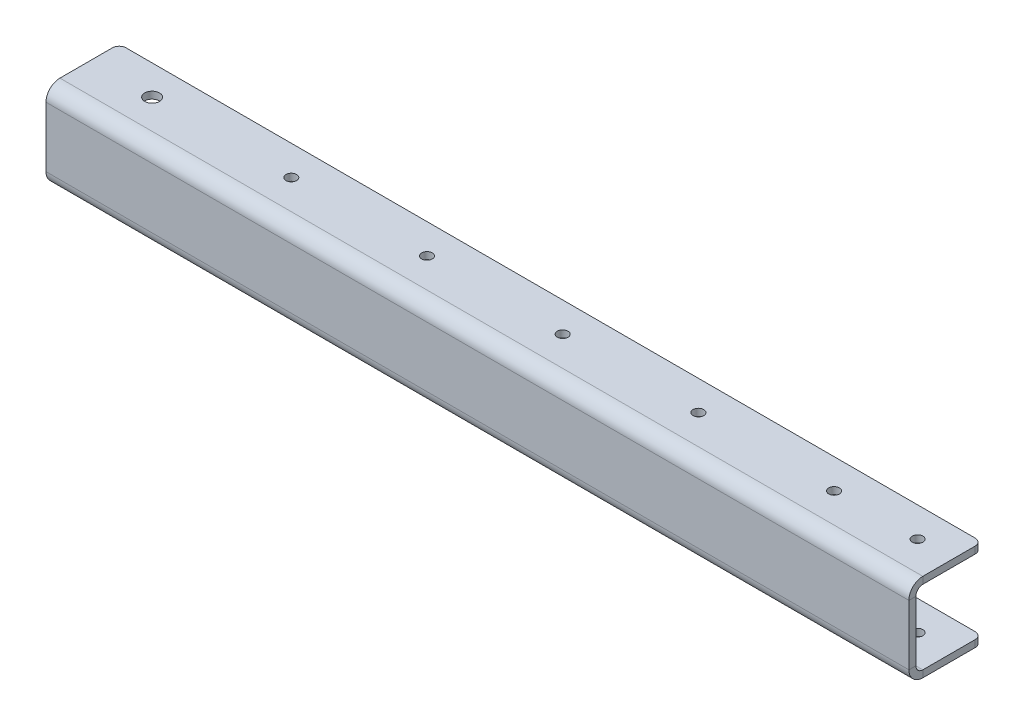
from build123d import *

# Parameters (mm, degrees)
BASE_FLANGE1_DEPTH = 393.7
SKETCH6_R          = 3.3782
SKETCH6_R_2        = 2.4257
CUT_EXTRUDE1_DEPTH = 397.892779602
FILLET1_R          = 3.175


# Sheet-metal steps are written as plain solids
with BuildPart() as part:
    # Sketch1 → Base-Flange1 (new body)
    with BuildSketch(Plane(origin=(0, 0, 0), x_dir=(0, 0, -1), z_dir=(1, 0, 0))):
        with BuildLine():
            Line((30.226, 33.782), (3.175, 33.782))
            ThreePointArc((3.175, 33.782), (0.92993597, 32.85206403), (0, 30.607))
            Line((0, 30.607), (0, 3.175))
            ThreePointArc((0, 3.175), (0.92993597, 0.92993597), (3.175, 0))
            Line((3.175, 0), (30.226, 0))
            Line((30.226, 0), (30.226, -3.175))
            Line((30.226, -3.175), (3.175, -3.175))
            ThreePointArc((3.175, -3.175), (-1.315128061, -1.315128061), (-3.175, 3.175))
            Line((-3.175, 3.175), (-3.175, 30.607))
            ThreePointArc((-3.175, 30.607), (-1.315128061, 35.097128061), (3.175, 36.957))
            Line((3.175, 36.957), (30.226, 36.957))
            Line((30.226, 36.957), (30.226, 33.782))
        make_face()
    extrude(amount=BASE_FLANGE1_DEPTH)

    # Sketch6 → Cut-Extrude1 (cut, through all)
    with BuildSketch(Plane(origin=(0, 36.957, 0), x_dir=(1, 0, 0), z_dir=(0, 1, 0))):
        with Locations(Location((28.575, 16.66875, 0), (0, 0, 270))):
            Circle(SKETCH6_R)
        with Locations(Location((92.075, 16.66875, 0), (0, 0, 270))):
            Circle(SKETCH6_R_2)
        with Locations(Location((339.725, 16.66875, 0), (0, 0, 270))):
            Circle(SKETCH6_R_2)
        with Locations(Location((377.825, 16.66875, 0), (0, 0, 270))):
            Circle(SKETCH6_R_2)
        with Locations(Location((153.9875, 16.66875, 0), (0, 0, 270))):
            Circle(SKETCH6_R_2)
        with Locations(Location((215.9, 16.66875, 0), (0, 0, 270))):
            Circle(SKETCH6_R_2)
        with Locations(Location((277.8125, 16.66875, 0), (0, 0, 270))):
            Circle(SKETCH6_R_2)
    extrude(amount=-CUT_EXTRUDE1_DEPTH, mode=Mode.SUBTRACT)

    # Fillet1
    fillet1_edges = [part.edges().sort_by_distance(p)[0] for p in [
        (0, -1.5875, -30.226),
        (0, 35.3695, -30.226),
        (393.7, -1.5875, -30.226),
        (393.7, 35.3695, -30.226),
    ]]
    fillet(fillet1_edges, radius=FILLET1_R)


solid = part.part
